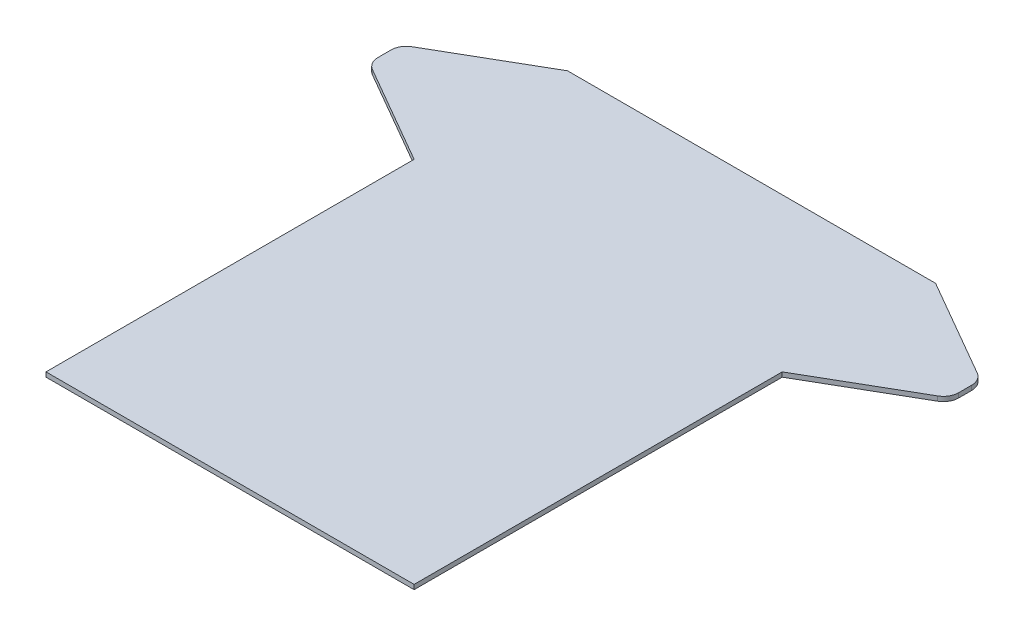
from build123d import *

# Parameters (mm, degrees)
BOSS_EXTRUDE2_DEPTH = 1.905
FILLET1_R           = 6.35


with BuildPart() as part:
    # Sketch3 → Boss-Extrude2 (new body)
    with BuildSketch(Plane(origin=(0, 0, 0), x_dir=(1, 0, 0), z_dir=(0, 1, 0))):
        Polygon((165.1, 215.9), (12.7, 215.9), (-31.294090512, 190.5), (-31.294090512, 177.8), (12.7, 152.4), (12.7, 0), (165.1, 0), (165.1, 152.4), (209.094090512, 177.8), (209.094090512, 190.5), align=None)
    extrude(amount=BOSS_EXTRUDE2_DEPTH)

    # Fillet1
    fillet1_edges = [part.edges().sort_by_distance(p)[0] for p in [
        (209.094090512, 0.9525, -177.8),
        (209.094090512, 0.9525, -190.5),
        (-31.294090512, 0.9525, -190.5),
        (-31.294090512, 0.9525, -177.8),
    ]]
    fillet(fillet1_edges, radius=FILLET1_R)


solid = part.part
